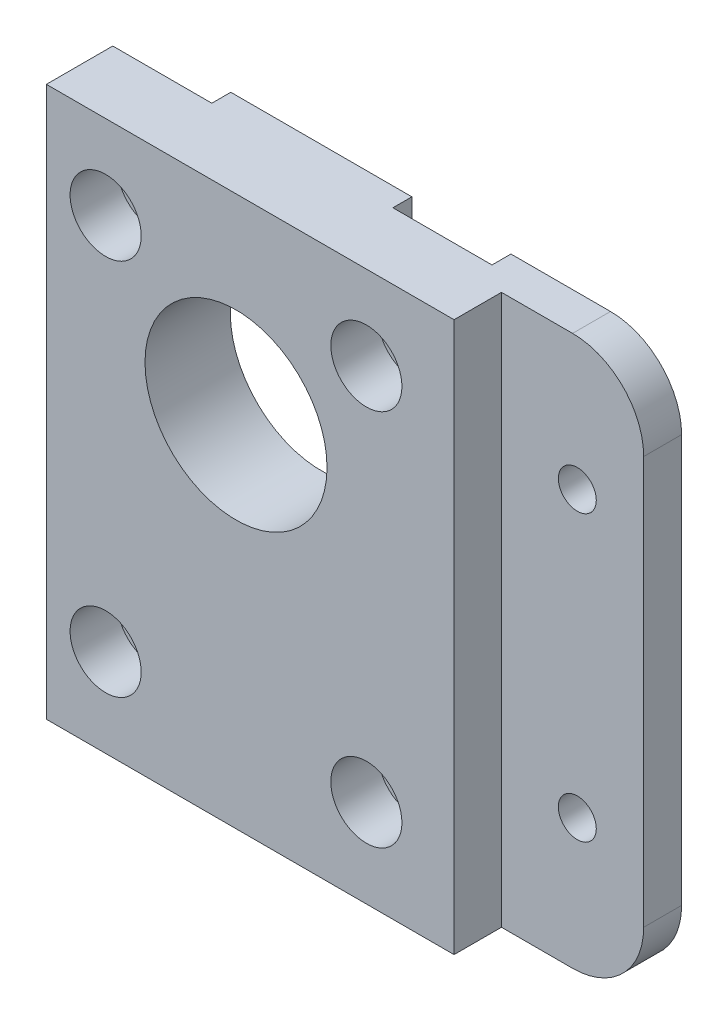
from build123d import *

# Parameters (mm, degrees)
SKETCH1_R           = 4.2
SKETCH1_R_2         = 9.6
BOSS_EXTRUDE1_DEPTH = 2
SKETCH4_W           = 58
SKETCH4_H           = 58
SKETCH4_R           = 2
SKETCH4_R_2         = 9.6
BOSS_EXTRUDE3_DEPTH = 2
SKETCH5_R           = 2
CUT_EXTRUDE1_DEPTH  = 4
SKETCH6_W           = 43
SKETCH6_H           = 58
SKETCH6_R           = 3.75
SKETCH6_R_2         = 9.6
BOSS_EXTRUDE4_DEPTH = 5
CUT_EXTRUDE2_DEPTH  = 49.062459363


with BuildPart() as part:
    # Sketch1 → Boss-Extrude1 (new body)
    with BuildSketch(Plane.XY):
        with BuildLine():
            Line((38, 29), (20, 29))
            Line((20, 29), (20, 21.814655719))
            Line((20, 21.814655719), (17.207493701, 17.765521586))
            ThreePointArc((17.207493701, 17.765521586), (12.50129538, 16.139920603), (9.55, 20.15))
            Line((9.55, 20.15), (9.55, 29))
            Line((9.55, 29), (-9.55, 29))
            Line((-9.55, 29), (-9.55, 20.15))
            ThreePointArc((-9.55, 20.15), (-12.50129538, 16.139920603), (-17.207493701, 17.765521586))
            Line((-17.207493701, 17.765521586), (-20, 21.814655719))
            Line((-20, 21.814655719), (-20, -16.278610808))
            Line((-20, -16.278610808), (-16.186, -16.278610808))
            Line((-16.186, -16.278610808), (-12.112917629, -13.378610808))
            ThreePointArc((-12.112917629, -13.378610808), (-6.255528438, -14.364), (-7.240917629, -20.221389192))
            Line((-7.240917629, -20.221389192), (-11.314, -23.121389192))
            Line((-11.314, -23.121389192), (-11.314, -29))
            Line((-11.314, -29), (9.55, -29))
            Line((9.55, -29), (9.55, -19.7))
            ThreePointArc((9.55, -19.7), (12.50129538, -15.689920603), (17.207493701, -17.315521586))
            Line((17.207493701, -17.315521586), (20, -21.364655719))
            Line((20, -21.364655719), (20, -29))
            Line((20, -29), (38, -29))
            Line((38, -29), (38, 29))
        make_face()
        with Locations((-5.725, -6.1)):
            Circle(SKETCH1_R, mode=Mode.SUBTRACT)
        with Locations((5.725, -6.1)):
            Circle(SKETCH1_R, mode=Mode.SUBTRACT)
        with Locations((0, 8.8)):
            Circle(SKETCH1_R_2, mode=Mode.SUBTRACT)
    extrude(amount=BOSS_EXTRUDE1_DEPTH)

    # Sketch4 → Boss-Extrude3 (add)
    with BuildSketch(Plane.XY.offset(2)):
        with Locations((9, 0)):
            Rectangle(SKETCH4_W, SKETCH4_H)
        with Locations((13.75, -19.7)):
            Circle(SKETCH4_R, mode=Mode.SUBTRACT)
        with Locations((-13.75, 20.15)):
            Circle(SKETCH4_R, mode=Mode.SUBTRACT)
        with Locations((13.75, 20.15)):
            Circle(SKETCH4_R, mode=Mode.SUBTRACT)
        with Locations((-13.75, -19.7)):
            Circle(SKETCH4_R, mode=Mode.SUBTRACT)
        with Locations((0, 8.8)):
            Circle(SKETCH4_R_2, mode=Mode.SUBTRACT)
    extrude(amount=BOSS_EXTRUDE3_DEPTH)

    # Sketch5 → Cut-Extrude1 (cut)
    with BuildSketch(Plane.XY.offset(4)):
        with Locations((31, 15)):
            Circle(SKETCH5_R)
        with Locations((31, -15)):
            Circle(SKETCH5_R)
    extrude(amount=-CUT_EXTRUDE1_DEPTH, mode=Mode.SUBTRACT)

    # Sketch6 → Boss-Extrude4 (add)
    with BuildSketch(Plane.XY.offset(4)):
        with Locations((1.5, 0)):
            Rectangle(SKETCH6_W, SKETCH6_H)
        with Locations((-13.75, -19.7)):
            Circle(SKETCH6_R, mode=Mode.SUBTRACT)
        with Locations((13.75, -19.7)):
            Circle(SKETCH6_R, mode=Mode.SUBTRACT)
        with Locations((0, 8.8)):
            Circle(SKETCH6_R_2, mode=Mode.SUBTRACT)
        with Locations((-13.75, 20.15)):
            Circle(SKETCH6_R, mode=Mode.SUBTRACT)
        with Locations((13.75, 20.15)):
            Circle(SKETCH6_R, mode=Mode.SUBTRACT)
    extrude(amount=BOSS_EXTRUDE4_DEPTH)

    # Sketch7 → Cut-Extrude2 (cut, through all)
    with BuildSketch(Plane.XY.offset(4)):
        with BuildLine():
            Line((30.5, 29), (38, 29))
            Line((38, 29), (38, 21.5))
            ThreePointArc((38, 21.5), (35.803300859, 26.803300859), (30.5, 29))
        make_face()
        with BuildLine():
            Line((38, -29), (38, -21.5))
            ThreePointArc((38, -21.5), (35.803300859, -26.803300859), (30.5, -29))
            Line((30.5, -29), (38, -29))
        make_face()
    extrude(amount=-CUT_EXTRUDE2_DEPTH, mode=Mode.SUBTRACT)


solid = part.part
